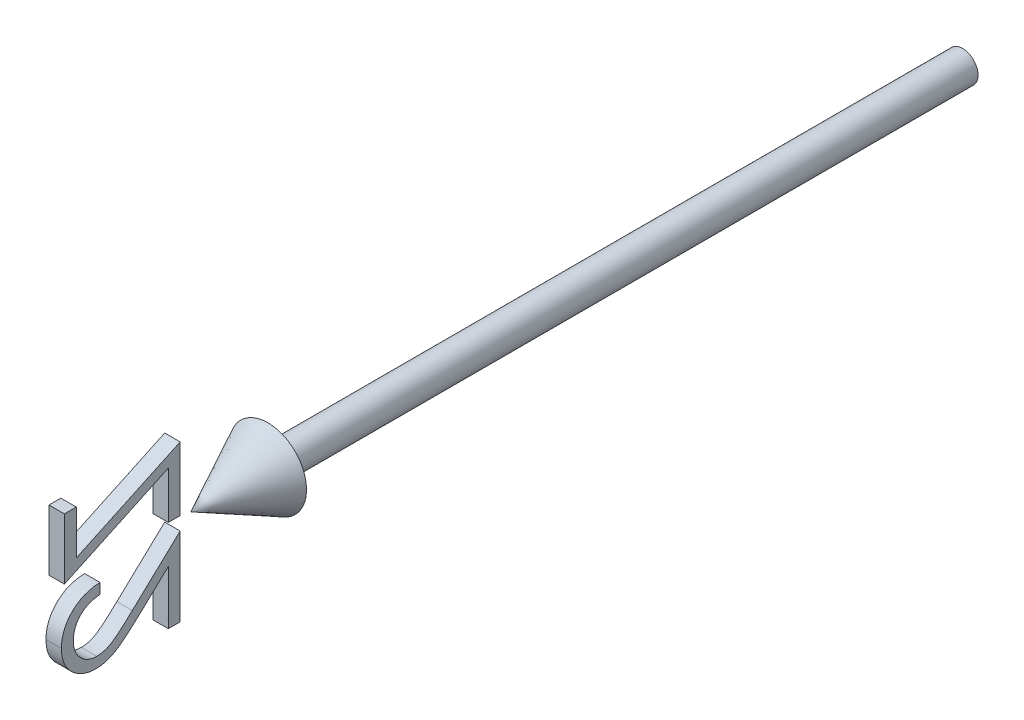
from build123d import *

# Parameters (mm, degrees)
BOSS_EXTRUDE1_DEPTH        = 1
BOSS_EXTRUDE1_DEPTH_BACK   = 1
BOSS_EXTRUDE1_2_DEPTH      = 1
BOSS_EXTRUDE1_2_DEPTH_BACK = 1


with BuildPart() as part:
    # Sketch2 → Revolve1 (revolve)
    with BuildSketch(Plane(origin=(0, 0, 0), x_dir=(1, 0, 0), z_dir=(0, 1, 0))):
        Polygon((0, -100), (5, -90), (2, -90), (2, 0), (0, 0), align=None)
    revolve(axis=Axis((0, 0, -41.949952025), (0, 0, 1)))


with BuildPart() as body_2:
    # Sketch3 → Boss-Extrude1 (new, two sides: drawn at the far end of the back side and taken through both)
    with BuildSketch(Plane(origin=(0, 0, 0), x_dir=(0, -1, 0), z_dir=(1, 0, 0)).offset(-BOSS_EXTRUDE1_DEPTH_BACK)):
        Polygon((-8.958586521, -115.829050545), (-8.958586521, -117.367512083), (-1.073971137, -117.367512083), (-7.366038444, -103.905973622), (-1.266278829, -103.905973622), (-1.266278829, -102.367512083), (-9.535509598, -102.367512083), (-3.243442291, -115.829050545), align=None)
    extrude(amount=BOSS_EXTRUDE1_DEPTH + BOSS_EXTRUDE1_DEPTH_BACK)


with BuildPart() as body_3:
    # Sketch3 → Boss-Extrude1 2 (new, two sides: drawn at the far end of the back side and taken through both)
    with BuildSketch(Plane(origin=(0, 0, 0), x_dir=(0, -1, 0), z_dir=(1, 0, 0)).offset(-BOSS_EXTRUDE1_2_DEPTH_BACK)):
        with BuildLine():
            Line((2.387567325, -112.752127468), (1.041413479, -112.752127468))
            add(Edge.make_bspline(
                [(1.041413479, -112.752127468), (1.050185498, -112.930717867), (1.067413511, -113.281464659), (1.14812731, -113.792840372), (1.263511735, -114.281691736), (1.427038382, -114.743827747), (1.628979502, -115.184769009), (1.876213873, -115.598660332), (2.163470857, -115.989609537), (2.490223471, -116.35021466), (2.844780172, -116.679852828), (3.225016614, -116.967524605), (3.627024685, -117.207798254), (4.047317539, -117.409753797), (4.490755987, -117.561161892), (4.953101254, -117.673553558), (5.436443094, -117.741162865), (5.765757104, -117.748431015), (5.933240402, -117.752127468)],
                knots=[0, 0, 0, 0, 1.100776268, 2.161895295, 3.184016182, 4.190939212, 5.176500551, 6.166955529, 7.155448256, 8.160289653, 9.16017456, 10.133824356, 11.091467644, 12.04088621, 13.000931625, 13.972173743, 14.968683325, 16, 16, 16, 16], degree=3))
            add(Edge.make_bspline(
                [(5.933240402, -117.752127468), (6.097729437, -117.748308187), (6.420944515, -117.740803438), (6.892475118, -117.675385557), (7.3424284, -117.575138484), (7.765705045, -117.426588115), (8.166649061, -117.240189896), (8.540296096, -117.008379289), (8.895681325, -116.742124794), (9.21536306, -116.428064559), (9.509029299, -116.092961496), (9.762151841, -115.735074242), (9.980142966, -115.365007801), (10.158561893, -114.979871417), (10.293811374, -114.578410898), (10.394018278, -114.164475183), (10.451301959, -113.733287174), (10.460045253, -113.44139354), (10.464490402, -113.292992852)],
                knots=[0, 0, 0, 0, 1.111674182, 2.184400057, 3.212814286, 4.223731311, 5.211378316, 6.196328225, 7.191884489, 8.207283132, 9.220262353, 10.201199469, 11.166417575, 12.120932471, 13.06540007, 14.026332106, 14.996573967, 16, 16, 16, 16], degree=3))
            add(Edge.make_bspline(
                [(10.464490402, -113.292992852), (10.457233447, -113.084073651), (10.442846886, -112.669901485), (10.319786944, -112.061265041), (10.127581249, -111.471583977), (9.896184514, -110.996979364), (9.662685279, -110.614586309), (9.452479023, -110.299587313), (9.204998347, -109.960507336), (8.922357616, -109.595973954), (8.599689356, -109.210761041), (8.245376446, -108.797009218), (7.850268631, -108.362369042), (7.573203067, -108.065310546), (7.429634633, -107.911382275)],
                knots=[0, 0, 0, 0, 1.184416499, 2.348048165, 3.509039915, 4.696071444, 5.333504901, 6.05069495, 6.844171097, 7.714965912, 8.667477798, 9.695072654, 10.805644396, 12, 12, 12, 12], degree=3))
            Line((7.429634633, -107.911382275), (3.676629825, -103.905973622))
            Line((3.676629825, -103.905973622), (10.656798094, -103.905973622))
            Line((10.656798094, -103.905973622), (10.656798094, -102.367512083))
            Line((10.656798094, -102.367512083), (0.464490402, -102.367512083))
            Line((0.464490402, -102.367512083), (6.281798094, -108.575444775))
            add(Edge.make_bspline(
                [(6.281798094, -108.575444775), (6.423441922, -108.723286597), (6.695510728, -109.007260479), (7.080161273, -109.421979259), (7.426195028, -109.806267841), (7.733841533, -110.1618291), (8.003353921, -110.486647334), (8.233869872, -110.783268069), (8.426408224, -111.049145791), (8.630458754, -111.361487822), (8.825034475, -111.743291523), (8.996046625, -112.207528642), (9.099575053, -112.686481184), (9.112057685, -113.010045114), (9.118336556, -113.172800545)],
                knots=[0, 0, 0, 0, 1.329530082, 2.553755191, 3.672934919, 4.687409497, 5.60679272, 6.413407421, 7.126401618, 7.737995624, 8.834647426, 9.90044882, 10.943907757, 12, 12, 12, 12], degree=3))
            add(Edge.make_bspline(
                [(9.118336556, -113.172800545), (9.115639933, -113.275160705), (9.110325407, -113.476892925), (9.06253371, -113.772469614), (8.992318222, -114.058693317), (8.884094464, -114.332025083), (8.754067603, -114.597840819), (8.5879487, -114.848058899), (8.398118417, -115.091208655), (8.1779246, -115.318952685), (7.936192702, -115.527601581), (7.68078048, -115.712415131), (7.410567913, -115.866869496), (7.126681095, -115.993484207), (6.829914955, -116.092807345), (6.519694576, -116.161629808), (6.196877375, -116.204840459), (5.976448106, -116.210686909), (5.864129825, -116.213665929)],
                knots=[0, 0, 0, 0, 0.991504627, 1.954065223, 2.895985987, 3.842598665, 4.797835564, 5.759220273, 6.74786863, 7.784730864, 8.824135544, 9.839918996, 10.835834653, 11.835434876, 12.84861661, 13.863796685, 14.911511676, 16, 16, 16, 16], degree=3))
            add(Edge.make_bspline(
                [(5.864129825, -116.213665929), (5.746796292, -116.210723352), (5.516372606, -116.204944617), (5.178786616, -116.161146583), (4.854486528, -116.094816692), (4.548469717, -115.98922005), (4.254331796, -115.865632976), (3.97957637, -115.705609455), (3.716485215, -115.522757835), (3.47034786, -115.309564459), (3.246169917, -115.06890125), (3.042233236, -114.8069436), (2.869435664, -114.519047531), (2.716045003, -114.212121191), (2.59873143, -113.877732047), (2.498436733, -113.524057994), (2.42558412, -113.146052935), (2.400450063, -112.885616858), (2.387567325, -112.752127468)],
                knots=[0, 0, 0, 0, 1.031072318, 2.024855787, 2.988461151, 3.935103592, 4.865765533, 5.788564469, 6.724086513, 7.67908574, 8.64457978, 9.611397706, 10.591395687, 11.591555111, 12.622101007, 13.700900657, 14.821571223, 16, 16, 16, 16], degree=3))
        make_face()
    extrude(amount=BOSS_EXTRUDE1_2_DEPTH + BOSS_EXTRUDE1_2_DEPTH_BACK)


solid = Compound([part.part, body_2.part, body_3.part])
